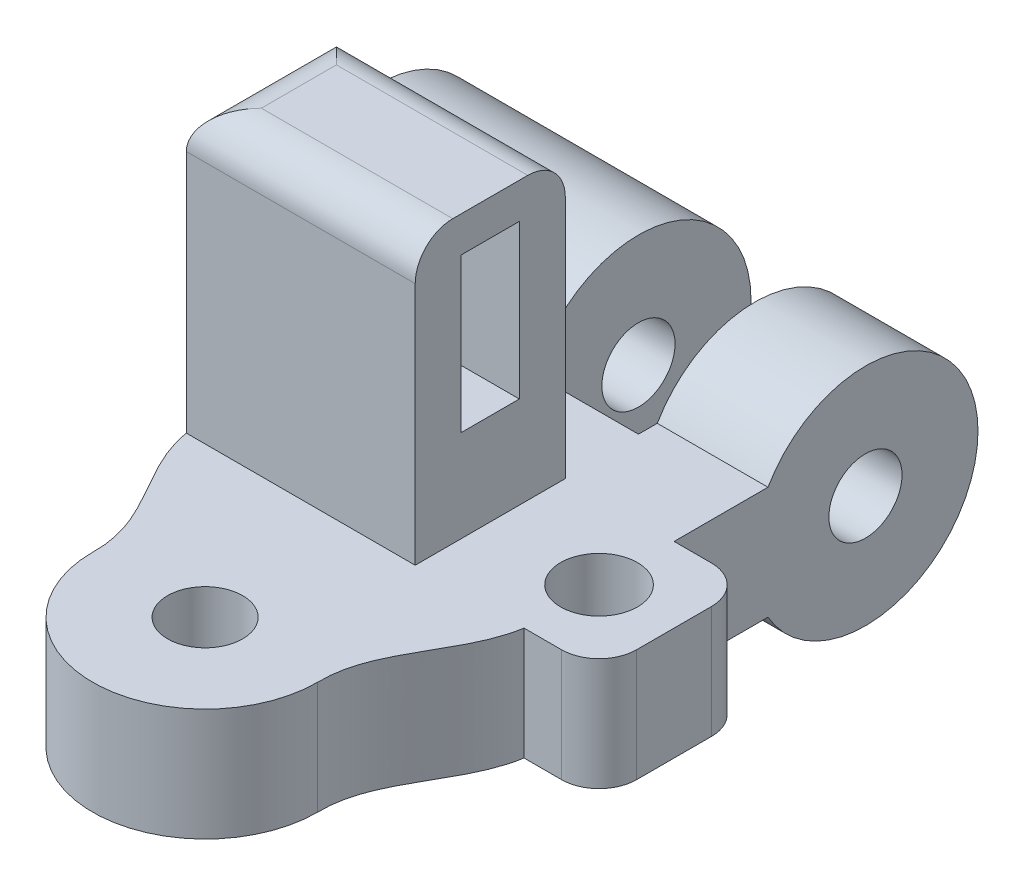
from build123d import *

# Parameters (mm, degrees)
SKETCH1_W           = 9
SKETCH1_H           = 9
BOSS_EXTRUDE1_DEPTH = 3
SKETCH2_W           = 2.95
SKETCH2_H           = 6
BOSS_EXTRUDE2_DEPTH = 6.1
FILLET1_R           = 3
SKETCH3_R           = 0.975
CUT_EXTRUDE1_DEPTH  = 11.1
CUT_EXTRUDE3_DEPTH  = 21.1
BOSS_EXTRUDE3_START = 4
SKETCH5_R           = 3
BOSS_EXTRUDE3_DEPTH = 4
SKETCH8_R           = 1.55
CUT_EXTRUDE4_DEPTH  = 3
CUT_EXTRUDE5_DEPTH  = 0.5
SKETCH10_W          = 9
SKETCH10_H          = 3
BOSS_EXTRUDE4_DEPTH = 4
SKETCH11_R          = 1
CUT_EXTRUDE6_DEPTH  = 4
CUT_EXTRUDE7_DEPTH  = 4
SKETCH13_W          = 6.1
SKETCH13_H          = 4
BOSS_EXTRUDE7_DEPTH = 7.5
SKETCH16_W          = 1.55
SKETCH16_H          = 4.1
CUT_EXTRUDE9_DEPTH  = 3.2
SKETCH17_W          = 4
SKETCH17_H          = 3
BOSS_EXTRUDE8_DEPTH = 2
SKETCH19_R          = 1.025
CUT_EXTRUDE10_DEPTH = 4
FILLET2_R           = 1


with BuildPart() as part:
    # Sketch1 → Boss-Extrude1 (new body)
    with BuildSketch(Plane(origin=(0, 0, 0), x_dir=(1, 0, 0), z_dir=(0, 1, 0))):
        with Locations((4.5, 4.5)):
            Rectangle(SKETCH1_W, SKETCH1_H)
    extrude(amount=BOSS_EXTRUDE1_DEPTH)

    # Sketch2 → Boss-Extrude2 (add)
    with BuildSketch(Plane(origin=(0, 0, -9), x_dir=(-1, 0, 0), z_dir=(0, 0, -1))):
        with Locations((-7.525, 1.5)):
            Rectangle(SKETCH2_W, SKETCH2_H)
        with Locations((-1.475, 1.5)):
            Rectangle(SKETCH2_W, SKETCH2_H)
    extrude(amount=BOSS_EXTRUDE2_DEPTH)

    # Fillet1
    fillet1_edges = [part.edges().sort_by_distance(p)[0] for p in [
        (1.475, 4.5, -15.1),
        (1.475, -1.5, -15.1),
        (7.525, -1.5, -15.1),
        (7.525, 4.5, -15.1),
    ]]
    fillet(fillet1_edges, radius=FILLET1_R - 0.0001)  # a hair under: the kernel refuses the full size

    # Sketch3 → Cut-Extrude1 (cut)
    with BuildSketch(Plane(origin=(9, 0, 0), x_dir=(0, 0, -1), z_dir=(1, 0, 0))):
        with Locations((12.1, 1.5)):
            Circle(SKETCH3_R)
    extrude(amount=-CUT_EXTRUDE1_DEPTH, mode=Mode.SUBTRACT)

    # Sketch6 → Cut-Extrude3 (cut)
    with BuildSketch(Plane.ZY):
        with BuildLine():
            Line((-12.1, 4.5), (-9, 4.5))
            Line((-9, 4.5), (-9, 3))
            Line((-9, 3), (-9.501923789, 3))
            ThreePointArc((-9.501923789, 3), (-10.6, 4.098076211), (-12.1, 4.5))
        make_face()
        with BuildLine():
            Line((-12.1, -1.5), (-9, -1.5))
            Line((-9, -1.5), (-9, 0))
            Line((-9, 0), (-9.501923789, 0))
            ThreePointArc((-9.501923789, 0), (-10.6, -1.098076211), (-12.1, -1.5))
        make_face()
    extrude(amount=-CUT_EXTRUDE3_DEPTH, mode=Mode.SUBTRACT)

    # Sketch5 → Boss-Extrude3 (add)
    with BuildSketch(Plane.ZY.offset(BOSS_EXTRUDE3_START)):
        with Locations((-12.1, 1.5)):
            Circle(SKETCH5_R)
    extrude(amount=-BOSS_EXTRUDE3_DEPTH)

    # Sketch8 → Cut-Extrude4 (cut)
    with BuildSketch(Plane(origin=(0, -1.5, 0), x_dir=(-1, 0, 0), z_dir=(0, -1, 0))):
        with Locations(Location((1.6, 12.1, 0), (0, 0, 90))):
            Circle(SKETCH8_R)
    extrude(amount=-CUT_EXTRUDE4_DEPTH, mode=Mode.SUBTRACT)

    # Sketch9 → Cut-Extrude5 (cut)
    with BuildSketch(Plane.ZY.offset(4)):
        with BuildLine():
            Line((-11.85, 1.5), (-11.85, -0.8))
            ThreePointArc((-11.85, -0.8), (-12.1, -1.05), (-12.35, -0.8))
            Line((-12.35, -0.8), (-12.35, 0.896446609))
            Line((-12.35, 0.896446609), (-13.549568901, -0.303122292))
            ThreePointArc((-13.549568901, -0.303122292), (-13.903122292, -0.303122292), (-13.903122292, 0.050431099))
            Line((-13.903122292, 0.050431099), (-12.703553391, 1.25))
            Line((-12.703553391, 1.25), (-14.4, 1.25))
            ThreePointArc((-14.4, 1.25), (-14.65, 1.5), (-14.4, 1.75))
            Line((-14.4, 1.75), (-12.703553391, 1.75))
            Line((-12.703553391, 1.75), (-13.903122292, 2.949568901))
            ThreePointArc((-13.903122292, 2.949568901), (-13.903122292, 3.303122292), (-13.549568901, 3.303122292))
            Line((-13.549568901, 3.303122292), (-12.35, 2.103553391))
            Line((-12.35, 2.103553391), (-12.35, 3.8))
            ThreePointArc((-12.35, 3.8), (-12.1, 4.05), (-11.85, 3.8))
            Line((-11.85, 3.8), (-11.85, 1.5))
        make_face()
    extrude(amount=-CUT_EXTRUDE5_DEPTH, mode=Mode.SUBTRACT)

    # Sketch10 → Boss-Extrude4 (add)
    with BuildSketch(Plane.XY):
        with Locations((4.5, 1.5)):
            Rectangle(SKETCH10_W, SKETCH10_H)
    extrude(amount=BOSS_EXTRUDE4_DEPTH)

    # Sketch11 → Cut-Extrude6 (cut)
    with BuildSketch(Plane(origin=(0, 3, 0), x_dir=(1, 0, 0), z_dir=(0, 1, 0))):
        with Locations(Location((4.5, -1, 0), (0, 0, 270))):
            Circle(SKETCH11_R)
    extrude(amount=-CUT_EXTRUDE6_DEPTH, mode=Mode.SUBTRACT)

    # Sketch12 → Cut-Extrude7 (cut)
    with BuildSketch(Plane(origin=(0, 3, 0), x_dir=(1, 0, 0), z_dir=(0, 1, 0))):
        with BuildLine():
            add(Edge.make_bspline(
                [(1.5, -1), (1.53988428, 0.555027292), (0.235256098, 1.545486909), (0, 3)],
                knots=[0, 0, 0, 0, 1, 1, 1, 1], degree=3))
            Line((0, 3), (0, -4))
            Line((0, -4), (4.5, -4))
            ThreePointArc((4.5, -4), (2.378679656, -3.121320344), (1.5, -1))
        make_face()
        with BuildLine():
            ThreePointArc((7.5, -1), (6.621320344, -3.121320344), (4.5, -4))
            Line((4.5, -4), (9, -4))
            Line((9, -4), (9, 3))
            add(Edge.make_bspline(
                [(7.5, -1), (7.46011572, 0.555027292), (8.764743902, 1.545486909), (9, 3)],
                knots=[0, 0, 0, 0, 1, 1, 1, 1], degree=3))
        make_face()
    extrude(amount=-CUT_EXTRUDE7_DEPTH, mode=Mode.SUBTRACT)

    # Sketch13 → Boss-Extrude7 (add)
    with BuildSketch(Plane(origin=(0, 3, 0), x_dir=(1, 0, 0), z_dir=(0, 1, 0))):
        with Locations((3.05, 5)):
            Rectangle(SKETCH13_W, SKETCH13_H)
    extrude(amount=BOSS_EXTRUDE7_DEPTH)

    # Sketch16 → Cut-Extrude9 (cut)
    with BuildSketch(Plane(origin=(6.1, 0, 0), x_dir=(0, 0, -1), z_dir=(1, 0, 0))):
        with Locations((5, 7.5)):
            Rectangle(SKETCH16_W, SKETCH16_H)
    extrude(amount=-CUT_EXTRUDE9_DEPTH, mode=Mode.SUBTRACT)

    # Sketch17 → Boss-Extrude8 (add)
    with BuildSketch(Plane(origin=(9, 0, 0), x_dir=(0, 0, -1), z_dir=(1, 0, 0))):
        with Locations((5, 1.5)):
            Rectangle(SKETCH17_W, SKETCH17_H)
    extrude(amount=BOSS_EXTRUDE8_DEPTH)

    # Sketch19 → Cut-Extrude10 (cut)
    with BuildSketch(Plane(origin=(0, 3, 0), x_dir=(1, 0, 0), z_dir=(0, 1, 0))):
        with Locations(Location((9, 5, 0), (0, 0, 270))):
            Circle(SKETCH19_R)
    extrude(amount=-CUT_EXTRUDE10_DEPTH, mode=Mode.SUBTRACT)

    # Fillet2
    fillet2_edges = [part.edges().sort_by_distance(p)[0] for p in [
        (0, 10.5, -5),
        (3.05, 10.5, -3),
        (3.05, 10.5, -7),
        (11, 1.5, -3),
        (11, 1.5, -7),
    ]]
    fillet(fillet2_edges, radius=FILLET2_R)


solid = part.part
